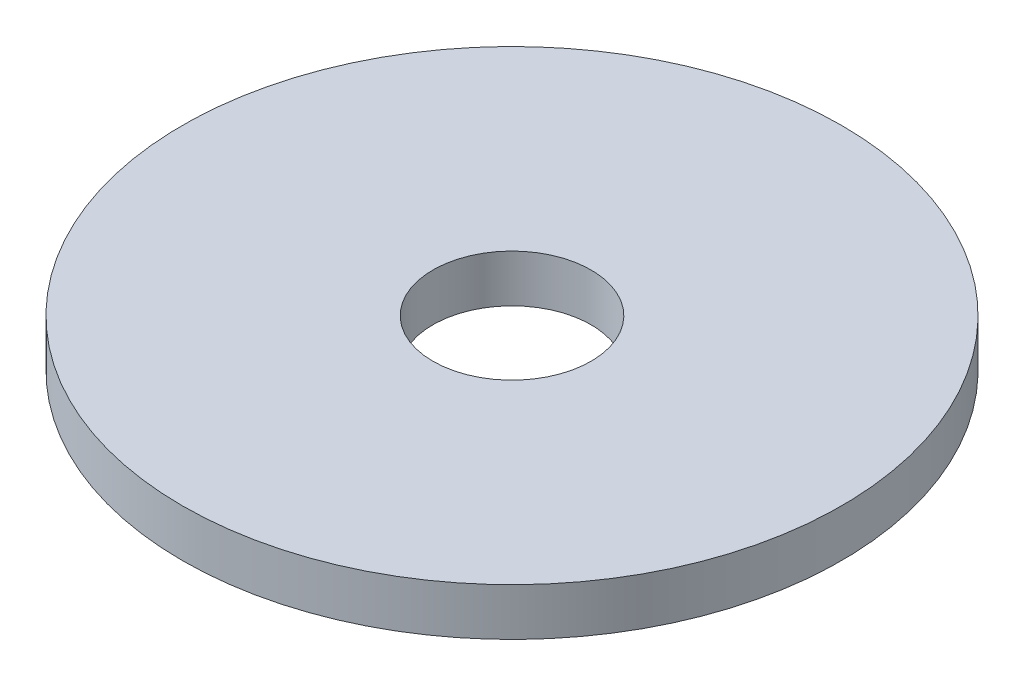
from build123d import *

# Parameters (mm, degrees)
SKETCH1_R           = 62.5
BOSS_EXTRUDE1_DEPTH = 9
SKETCH2_R           = 15
CUT_EXTRUDE1_DEPTH  = 89.845371292


with BuildPart() as part:
    # Sketch1 → Boss-Extrude1 (new body)
    with BuildSketch(Plane(origin=(0, 0, 0), x_dir=(1, 0, 0), z_dir=(0, 1, 0))):
        Circle(SKETCH1_R)
    extrude(amount=BOSS_EXTRUDE1_DEPTH)

    # Sketch2 → Cut-Extrude1 (cut, through all)
    with BuildSketch(Plane(origin=(0, 0, 0), x_dir=(1, 0, 0), z_dir=(0, 1, 0))):
        Circle(SKETCH2_R)
    extrude(amount=CUT_EXTRUDE1_DEPTH, mode=Mode.SUBTRACT)


solid = part.part
